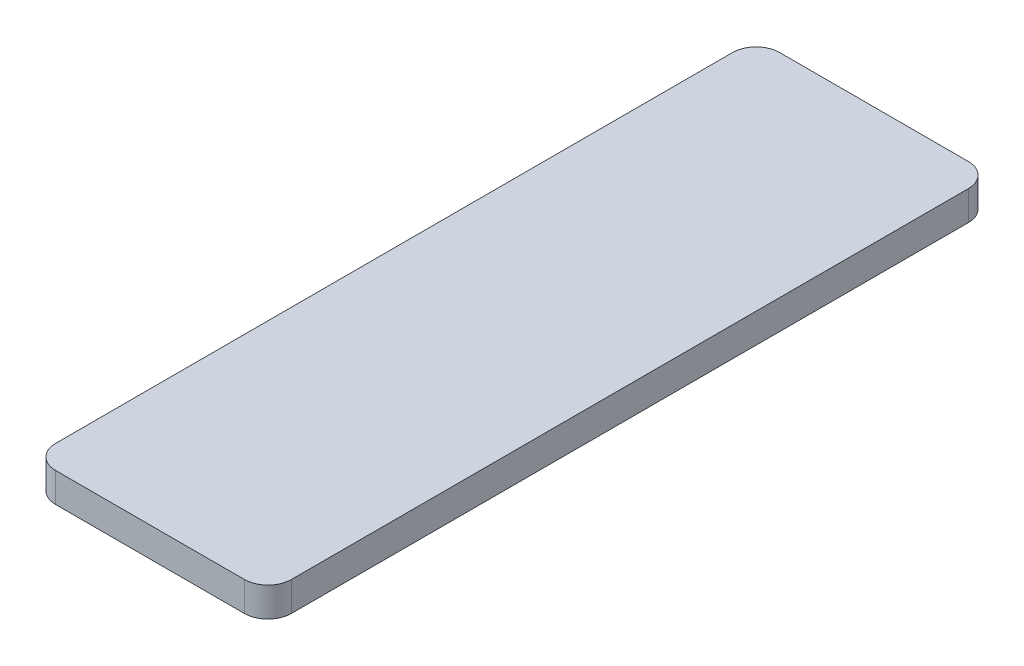
from build123d import *

# Parameters (mm, degrees)
SKETCH1_W           = 25.4
SKETCH1_H           = 78
BOSS_EXTRUDE1_DEPTH = 3.175
FILLET1_R           = 2.54


with BuildPart() as part:
    # Sketch1 → Boss-Extrude1 (new body)
    with BuildSketch(Plane(origin=(0, 0, 0), x_dir=(1, 0, 0), z_dir=(0, 1, 0))):
        with Locations((12.7, 39)):
            Rectangle(SKETCH1_W, SKETCH1_H)
    extrude(amount=BOSS_EXTRUDE1_DEPTH)

    # Fillet1
    fillet1_edges = [part.edges().sort_by_distance(p)[0] for p in [
        (25.4, 1.5875, 0),
        (0, 1.5875, 0),
        (25.4, 1.5875, -78),
        (0, 1.5875, -78),
    ]]
    fillet(fillet1_edges, radius=FILLET1_R)


solid = part.part
